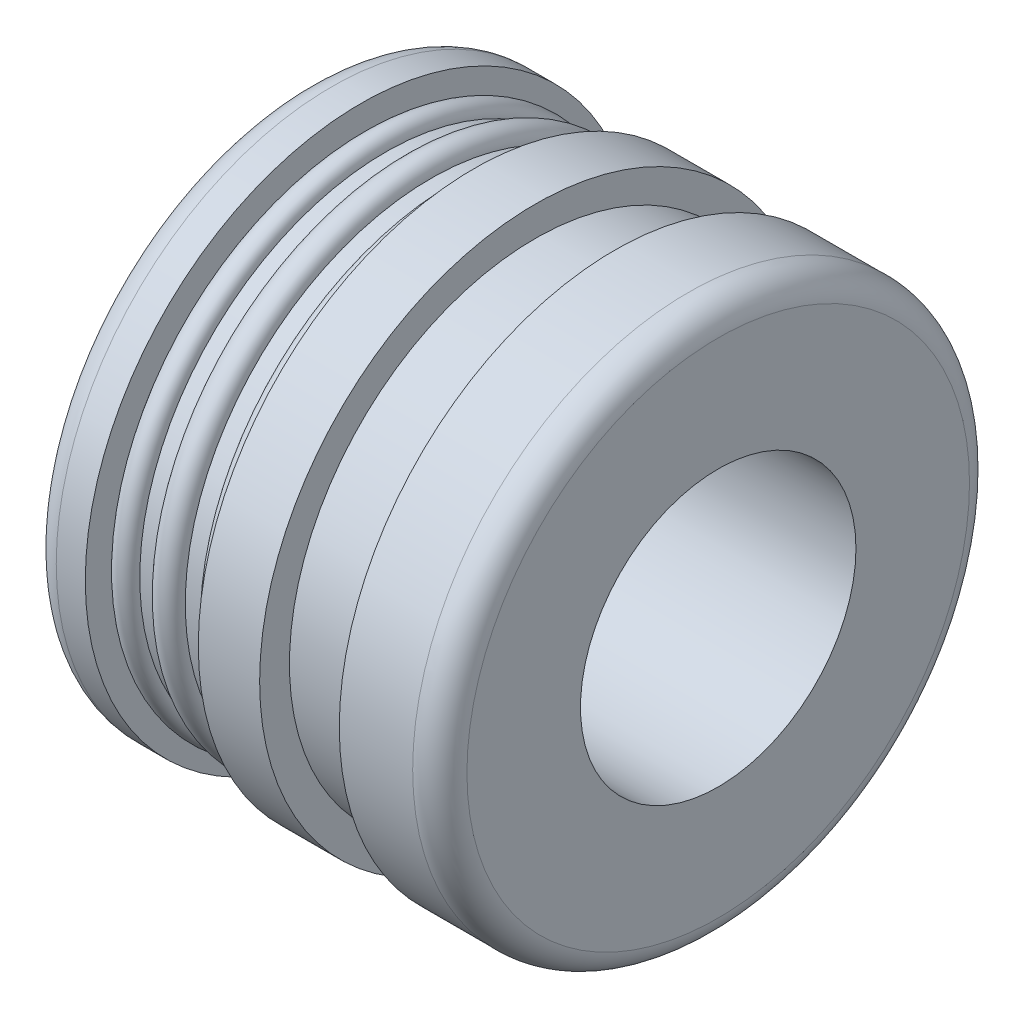
from build123d import *


with BuildPart() as part:
    # Sketch1 → Revolve1 (revolve)
    with BuildSketch(Plane.XY):
        with BuildLine():
            Line((-7.739135949, 11.32661101), (-7.739135949, 12.7))
            Line((-7.739135949, 12.7), (-9.078601787, 12.7))
            ThreePointArc((-9.078601787, 12.7), (-9.979939066, 12.268833482), (-10.3124, 11.32661101))
            Line((-10.3124, 11.32661101), (-10.3124, 6.35))
            Line((-10.3124, 6.35), (8.737600003, 6.35))
            Line((8.737600003, 6.35), (8.737600003, 11.583899001))
            ThreePointArc((8.737600003, 11.583899001), (8.276468266, 12.428702849), (7.353032358, 12.7))
            Line((7.353032358, 12.7), (3.968787666, 12.7))
            Line((3.968787666, 12.7), (3.968787666, 11.32661101))
            Line((3.968787666, 11.32661101), (0.297659075, 11.32661101))
            Line((0.297659075, 11.32661101), (0.297659075, 12.7))
            Line((0.297659075, 12.7), (-2.530102137, 12.7))
            Line((-2.530102137, 12.7), (-2.530102137, 11.32661101))
            Line((-2.530102137, 11.32661101), (-2.574075102, 11.32661101))
            ThreePointArc((-2.574075102, 11.32661101), (-3.086168863, 11.838704771), (-3.598262623, 11.32661101))
            Line((-3.598262623, 11.32661101), (-4.504334849, 11.32661101))
            ThreePointArc((-4.504334849, 11.32661101), (-5.134619043, 11.956895205), (-5.764903238, 11.32661101))
            Line((-5.764903238, 11.32661101), (-6.601622574, 11.32661101))
            ThreePointArc((-6.601622574, 11.32661101), (-7.140925132, 11.865913569), (-7.680227691, 11.32661101))
            Line((-7.680227691, 11.32661101), (-7.739135949, 11.32661101))
        make_face()
    revolve(axis=Axis((0, 0, 0), (-1, 0, 0)))


solid = part.part
